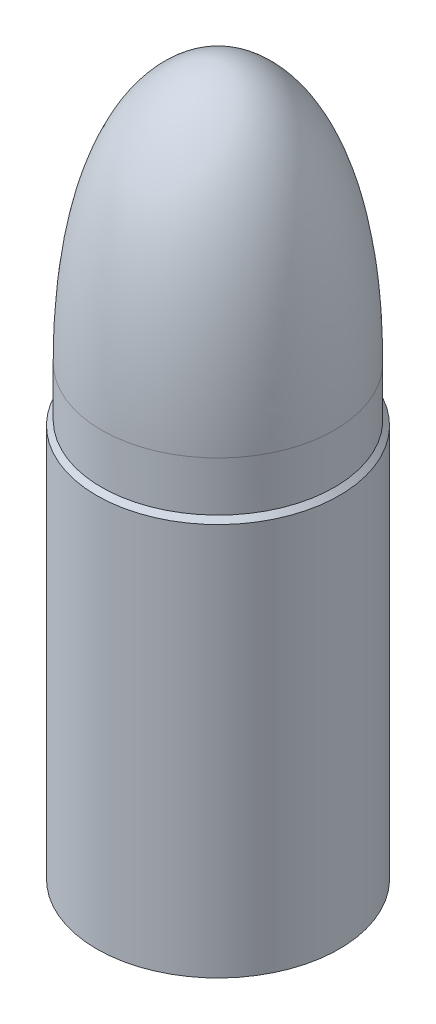
from build123d import *

# Parameters (mm, degrees)
SKETCH1_R                = 36.5
SKETCH1_R_2              = 35
BOSS_EXTRUDE1_DEPTH      = 20
BOSS_EXTRUDE2_DEPTH      = 120
BOSS_EXTRUDE2_DEPTH_BACK = 5
SKETCH3_R                = 38
SKETCH3_R_2              = 36.5
CHAMFER1_SIZE            = 2
SKETCH4_R                = 37.15
CUT_EXTRUDE1_DEPTH       = 120


with BuildPart() as part:
    # Sketch1 → Boss-Extrude1 (new body)
    with BuildSketch(Plane(origin=(0, 0, 0), x_dir=(1, 0, 0), z_dir=(0, 1, 0))):
        with Locations(Location((0, 0, 0), (0, 0, 270))):
            Circle(SKETCH1_R)
        with Locations(Location((0, 0, 0), (0, 0, 270))):
            Circle(SKETCH1_R_2, mode=Mode.SUBTRACT)
    extrude(amount=BOSS_EXTRUDE1_DEPTH)

    # Sketch2 → Revolve1 (revolve)
    with BuildSketch(Plane.XY, mode=Mode.PRIVATE) as revolve1_sk:
        with BuildLine():
            Line((-35, 20), (-36.5, 20))
            add(Edge.make_bspline(
                [(-36.5, 20), (-36.5, 20.938203754), (-36.489872815, 22.828803886), (-36.429914329, 26.496139533), (-36.282028405, 30.946908345), (-35.992678983, 36.053561075), (-35.464097096, 42.564076378), (-34.547626097, 50.148542942), (-33.076762757, 58.396561812), (-31.272577792, 65.822093819), (-28.472409657, 74.667565146), (-24.325017143, 83.822828988), (-18.603719652, 92.00577673), (-13.454241979, 96.674123666), (-9.254678436, 99.216783088), (-6.104208908, 100.550031186), (-3.516650787, 101.201383216), (-1.484729716, 101.45792619), (-0.497779404, 101.5), (0, 101.5)],
                knots=[0, 0, 0, 0, 0.015625, 0.03125, 0.0625, 0.09375, 0.125, 0.1875, 0.25, 0.3125, 0.375, 0.5, 0.625, 0.75, 0.8125, 0.875, 0.9375, 0.96875, 1, 1, 1, 1], degree=3))
            Line((0, 101.5), (0, 100))
            add(Edge.make_bspline(
                [(-35, 20), (-35, 80.332266649), (-14.376326679, 100), (0, 100)],
                knots=[0, 0, 0, 0, 1, 1, 1, 1], degree=3))
        make_face()
    revolve(revolve1_sk.sketch.rotate(Axis((0, 20, 0), (0, 1, 0)), 270), axis=Axis((0, 20, 0), (0, 1, 0)))

    # Sketch3 → Boss-Extrude2 (add, two sides: drawn at the far end of the back side and taken through both)
    with BuildSketch(Plane.XZ.offset(-BOSS_EXTRUDE2_DEPTH_BACK)):
        with Locations(Location((0, 0, 0), (0, 0, 270))):
            Circle(SKETCH3_R)
        with Locations(Location((0, 0, 0), (0, 0, 270))):
            Circle(SKETCH3_R_2, mode=Mode.SUBTRACT)
    extrude(amount=BOSS_EXTRUDE2_DEPTH + BOSS_EXTRUDE2_DEPTH_BACK)

    # Chamfer1
    # the kernel refuses this chamfer: 2 mm, written as the material it takes off along each edge
    with BuildSketch(Plane(origin=(0, 5, 0), x_dir=(0, 0, -1), z_dir=(-1, 0, 0))) as chamfer1_piece_1_section:
        Polygon((38 - CHAMFER1_SIZE, 0), (38, CHAMFER1_SIZE), (38, 0), align=None)
    chamfer1_piece_1 = revolve(axis=Axis((0, 5, 0), (0, -1, 0)), mode=Mode.PRIVATE)
    chamfer1_piece_1 = chamfer1_piece_1 - Plane(origin=(0, 3.777023611, 0), x_dir=(0, 0, 1), z_dir=(0, -1, 0)) * Cylinder(36.5, 153, mode=Mode.PRIVATE)
    add(chamfer1_piece_1, mode=Mode.SUBTRACT)

    # Sketch4 → Cut-Extrude1 (cut)
    with BuildSketch(Plane.XZ.offset(120)):
        with Locations(Location((0, 0, 0), (0, 0, 270))):
            Circle(SKETCH4_R)
    extrude(amount=-CUT_EXTRUDE1_DEPTH, mode=Mode.SUBTRACT)


solid = part.part
